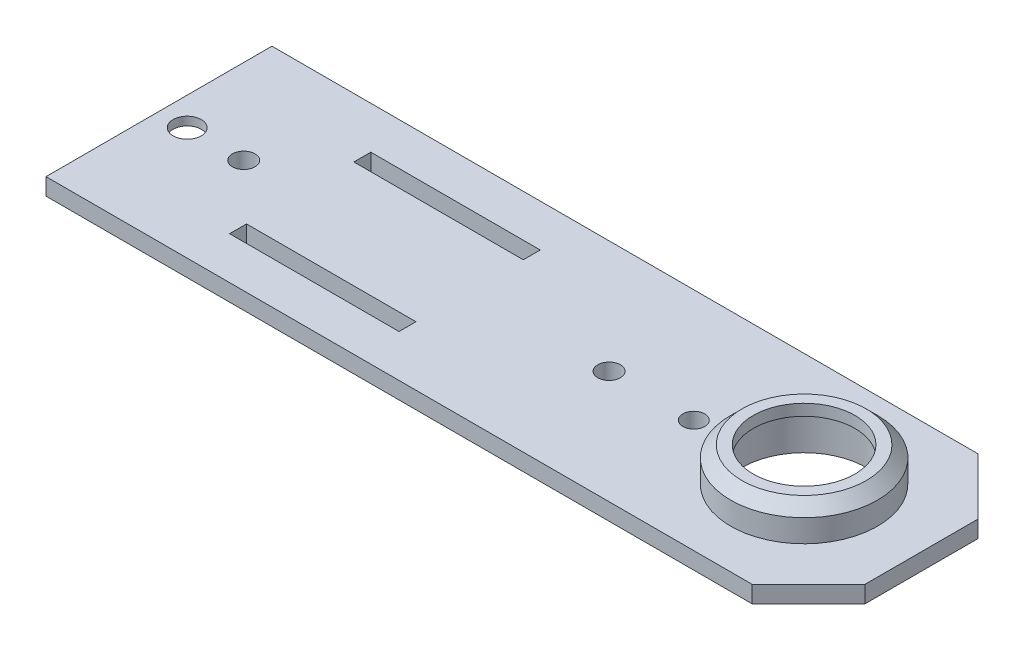
from build123d import *

# Parameters (mm, degrees)
CROQUIS1_R              = 11
CROQUIS1_R_2            = 2
CROQUIS1_R_3            = 1.937672591
CROQUIS1_W              = 30
CROQUIS1_H              = 3
SALIENTE_EXTRUIR1_DEPTH = 3
CROQUIS2_R              = 13
CROQUIS2_R_2            = 11
SALIENTE_EXTRUIR2_DEPTH = 4
CROQUIS3_R              = 13
CROQUIS3_R_2            = 9
SALIENTE_EXTRUIR3_DEPTH = 2
CHAFL_N1_SIZE           = 2
CHAFL_N2_SIZE           = 10
CROQUIS4_W              = 10
CROQUIS4_H              = 20
CROQUIS4_R              = 2.5
SALIENTE_EXTRUIR4_DEPTH = 1.5


with BuildPart() as part:
    # Croquis1 → Saliente-Extruir1 (new body)
    with BuildSketch(Plane(origin=(0, 0, 0), x_dir=(1, 0, 0), z_dir=(0, 1, 0))):
        Polygon((-67.5, -20), (67.5, -20), (67.5, 20), (-67.5, 20), (-67.5, 10), (-57.5, 10), (-57.5, -10), (-67.5, -10), align=None)
        with Locations((46.713951104, 0)):
            Circle(CROQUIS1_R, mode=Mode.SUBTRACT)
        with Locations((-52.5, 0)):
            Circle(CROQUIS1_R_2, mode=Mode.SUBTRACT)
        with Locations((27.185770037, 0)):
            Circle(CROQUIS1_R_3, mode=Mode.SUBTRACT)
        with Locations((12.185770037, 0)):
            Circle(CROQUIS1_R_2, mode=Mode.SUBTRACT)
        with Locations((-27.5, 11)):
            Rectangle(CROQUIS1_W, CROQUIS1_H, mode=Mode.SUBTRACT)
        with Locations((-27.5, -11)):
            Rectangle(CROQUIS1_W, CROQUIS1_H, mode=Mode.SUBTRACT)
    extrude(amount=SALIENTE_EXTRUIR1_DEPTH)

    # Croquis2 → Saliente-Extruir2 (add)
    with BuildSketch(Plane(origin=(0, 3, 0), x_dir=(1, 0, 0), z_dir=(0, 1, 0))):
        with Locations((46.713951104, 0)):
            Circle(CROQUIS2_R)
        with Locations((46.713951104, 0)):
            Circle(CROQUIS2_R_2, mode=Mode.SUBTRACT)
    extrude(amount=SALIENTE_EXTRUIR2_DEPTH)

    # Croquis3 → Saliente-Extruir3 (add)
    with BuildSketch(Plane(origin=(0, 7, 0), x_dir=(1, 0, 0), z_dir=(0, 1, 0))):
        with Locations((46.713951104, 0)):
            Circle(CROQUIS3_R)
        with Locations((46.713951104, 0)):
            Circle(CROQUIS3_R_2, mode=Mode.SUBTRACT)
    extrude(amount=SALIENTE_EXTRUIR3_DEPTH)

    # Chaflán1
    chafl_n1_edges = [part.edges().sort_by_distance(p)[0] for p in [
        (33.713951104, 9, 0),
    ]]
    chamfer(chafl_n1_edges, length=CHAFL_N1_SIZE)

    # Chaflán2
    chafl_n2_edges = [part.edges().sort_by_distance(p)[0] for p in [
        (67.5, 1.5, -20),
        (67.5, 1.5, 20),
    ]]
    chamfer(chafl_n2_edges, length=CHAFL_N2_SIZE)

    # Croquis4 → Saliente-Extruir4 (add)
    with BuildSketch(Plane(origin=(0, 3, 0), x_dir=(1, 0, 0), z_dir=(0, 1, 0))):
        with Locations((-62.5, 0)):
            Rectangle(CROQUIS4_W, CROQUIS4_H)
        with Locations((-62.5, 0)):
            Circle(CROQUIS4_R, mode=Mode.SUBTRACT)
    extrude(amount=-SALIENTE_EXTRUIR4_DEPTH)


solid = part.part
